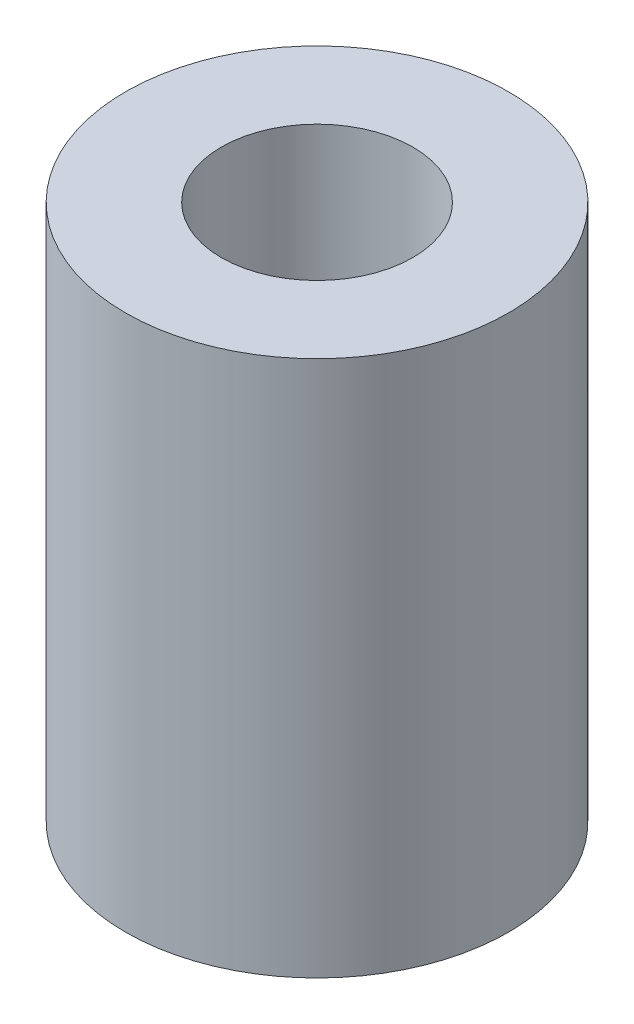
from build123d import *

# Parameters (mm, degrees)
SKETCH1_R           = 2.5
SKETCH1_R_2         = 1.25
BOSS_EXTRUDE1_DEPTH = 7


with BuildPart() as part:
    # Sketch1 → Boss-Extrude1 (new body)
    with BuildSketch(Plane(origin=(0, 0, 0), x_dir=(1, 0, 0), z_dir=(0, 1, 0))):
        Circle(SKETCH1_R)
        Circle(SKETCH1_R_2, mode=Mode.SUBTRACT)
    extrude(amount=BOSS_EXTRUDE1_DEPTH)


solid = part.part
